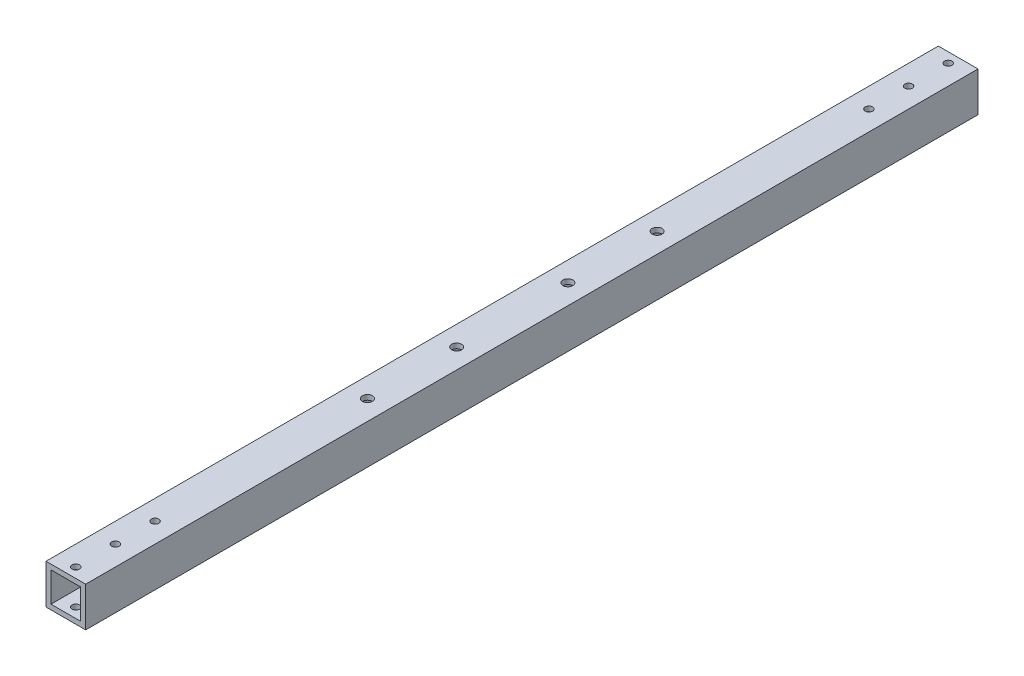
from build123d import *

# Parameters (mm, degrees)
SKETCH1_W                      = 25.4
SKETCH1_H                      = 25.4
SKETCH1_W_2                    = 19.05
SKETCH1_H_2                    = 19.05
EXTRUDE_THIN1_DEPTH            = 571.5
F_3_16_0_1875_DIAMETER_HOLE1_D = 4.7625
F_1_4_0_25_DIAMETER_HOLE1_D    = 6.35


with BuildPart() as part:
    # Sketch1 → Extrude-Thin1 (new body)
    with BuildSketch(Plane.XY):
        Rectangle(SKETCH1_W, SKETCH1_H)
        Rectangle(SKETCH1_W_2, SKETCH1_H_2, mode=Mode.SUBTRACT)
    extrude(amount=EXTRUDE_THIN1_DEPTH)

    # 3/16 (0.1875) Diameter Hole1 (through all)
    with Locations(Plane(origin=(0, 12.7, 565.15), x_dir=(0, 0, 1), z_dir=(0, 1, 0))):
        with Locations((0, 0), (-558.8, 0), (-533.4, 0), (-508, 0), (-25.4, 0), (-50.8, 0)):
            Hole(F_3_16_0_1875_DIAMETER_HOLE1_D / 2)

    # 1/4 (0.25) Diameter Hole1 (through all)
    with Locations(Plane(origin=(0, 12.7, 0), x_dir=(1, 0, 0), z_dir=(0, 1, 0))):
        with Locations((0, -321.183), (0, -378.333), (0, -192.786), (0, -249.936)):
            Hole(F_1_4_0_25_DIAMETER_HOLE1_D / 2)


solid = part.part
